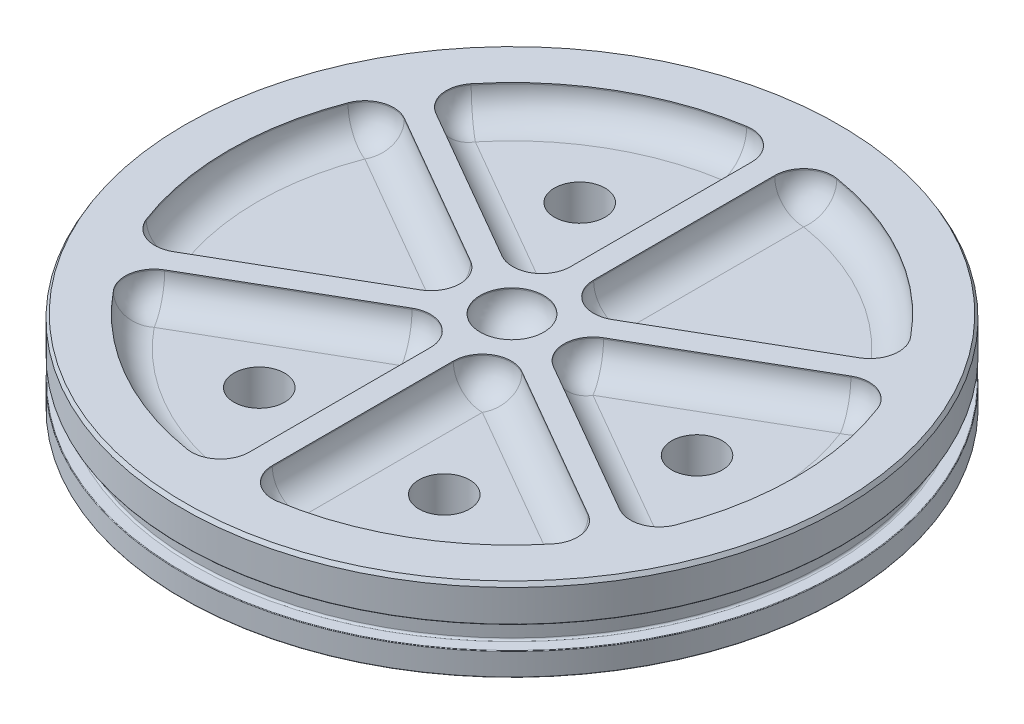
from build123d import *

# Parameters (mm, degrees)
SKETCH6_R                        = 65.405
BOSS_EXTRUDE1_DEPTH              = 2.54
PIPE_TAP_DRILL_FOR_1_4_TAP_GN2_D = 11.1252
CNC_ID_FILLET_R                  = 0.4064
CNC_OD_FILLET_R                  = 0.127
CNC_CHAMFERS_SIZE                = 0.508
CNC_CHAMFERS_SIZE2               = 0.87988181
BOSS_EXTRUDE2_START              = -6.604
SKETCH7_R                        = 6.985
BOSS_EXTRUDE2_DEPTH              = 6.604
FILLET1_R                        = 6.35
SKETCH8_R                        = 6.985
CUT_EXTRUDE1_DEPTH               = 3.81
FILLET2_R                        = 6.35


with BuildPart() as part:
    # Sketch1 → Revolve1 (revolve)
    with BuildSketch(Plane.XY, mode=Mode.PRIVATE) as revolve1_sk:
        Polygon((0, 0), (72.39, 0), (72.39, 5.08), (69.469, 5.08), (69.469, 10.0584), (72.39, 10.0584), (72.39, 18.034), (62.23, 18.034), (62.23, 11.43), (0, 11.43), align=None)
    revolve(revolve1_sk.sketch.rotate(Axis((0, 48.192213231, 0), (0, -1, 0)), 180), axis=Axis((0, 48.192213231, 0), (0, -1, 0)))

    # Sketch6 → Boss-Extrude1 (add)
    with BuildSketch(Plane.XZ):
        Circle(SKETCH6_R)
    extrude(amount=BOSS_EXTRUDE1_DEPTH)

    # Pipe Tap Drill for 1/4 Tap - GN2 (through all)
    with Locations(Plane(origin=(0, 11.43, 0), x_dir=(1, 0, 0), z_dir=(0, 1, 0))):
        with Locations((20.32, -35.19527241), (-20.32, 35.19527241), (40.64, 0), (-20.32, -35.19527241)):
            Hole(PIPE_TAP_DRILL_FOR_1_4_TAP_GN2_D / 2)

    # CNC ID Fillet
    cnc_id_fillet_edges = [part.edges().sort_by_distance(p)[0] for p in [
        (69.469, 10.0584, 0),
        (69.469, 5.08, 0),
        (-65.405, 0, 0),
    ]]
    fillet(cnc_id_fillet_edges, radius=CNC_ID_FILLET_R)

    # CNC OD Fillet
    cnc_od_fillet_edges = [part.edges().sort_by_distance(p)[0] for p in [
        (72.39, 5.08, 0),
        (72.39, 0, 0),
        (-65.405, -2.54, 0),
        (72.39, 10.0584, 0),
    ]]
    fillet(cnc_od_fillet_edges, radius=CNC_OD_FILLET_R)

    # CNC Chamfers
    cnc_chamfers_edges = [part.edges().sort_by_distance(p)[0] for p in [
        (72.39, 18.034, 0),
    ]]
    cnc_chamfers_side = [part.faces().sort_by_distance(p)[0] for p in [
        (70.342501604, 18.034, 0),
    ]]
    chamfer(cnc_chamfers_edges, length=CNC_CHAMFERS_SIZE, length2=CNC_CHAMFERS_SIZE2, reference=cnc_chamfers_side[0])

    # Sketch7 → Boss-Extrude2 (add)
    with BuildSketch(Plane(origin=(0, 18.034, 0), x_dir=(1, 0, 0), z_dir=(0, 1, 0)).offset(BOSS_EXTRUDE2_START)):
        with BuildLine():
            ThreePointArc((12.065, 9.898670365), (5.715, 9.898670365), (2.54, 15.397931679))
            Line((2.54, 15.397931679), (2.54, 62.178141658))
            ThreePointArc((2.54, 62.178141658), (0, 62.23), (-2.54, 62.178141658))
            Line((-2.54, 62.178141658), (-2.54, 15.397931679))
            ThreePointArc((-2.54, 15.397931679), (-5.715, 9.898670365), (-12.065, 9.898670365))
            Line((-12.065, 9.898670365), (-52.577850236, 33.288775354))
            ThreePointArc((-52.577850236, 33.288775354), (-53.892760878, 31.115), (-55.117850236, 28.889366303))
            Line((-55.117850236, 28.889366303), (-14.605, 5.499261314))
            ThreePointArc((-14.605, 5.499261314), (-11.43, 0), (-14.605, -5.499261314))
            Line((-14.605, -5.499261314), (-55.117850236, -28.889366303))
            ThreePointArc((-55.117850236, -28.889366303), (-53.892760878, -31.115), (-52.577850236, -33.288775354))
            Line((-52.577850236, -33.288775354), (-12.065, -9.898670365))
            ThreePointArc((-12.065, -9.898670365), (-5.715, -9.898670365), (-2.54, -15.397931679))
            Line((-2.54, -15.397931679), (-2.54, -62.178141658))
            ThreePointArc((-2.54, -62.178141658), (0, -62.23), (2.54, -62.178141658))
            Line((2.54, -62.178141658), (2.54, -15.397931679))
            ThreePointArc((2.54, -15.397931679), (5.715, -9.898670365), (12.065, -9.898670365))
            Line((12.065, -9.898670365), (52.577850236, -33.288775354))
            ThreePointArc((52.577850236, -33.288775354), (53.892760878, -31.115), (55.117850236, -28.889366303))
            Line((55.117850236, -28.889366303), (14.605, -5.499261314))
            ThreePointArc((14.605, -5.499261314), (11.43, 0), (14.605, 5.499261314))
            Line((14.605, 5.499261314), (55.117850236, 28.889366303))
            ThreePointArc((55.117850236, 28.889366303), (53.892760878, 31.115), (52.577850236, 33.288775354))
            Line((52.577850236, 33.288775354), (12.065, 9.898670365))
        make_face()
        with Locations(Location((0, 0, 0), (0, 0, 180))):
            Circle(SKETCH7_R, mode=Mode.SUBTRACT)
    extrude(amount=BOSS_EXTRUDE2_DEPTH)

    # Fillet1
    fillet1_edges = [part.edges().sort_by_distance(p)[0] for p in [
        (-32.321425118, 11.43, -21.59372286),
        (-52.577850236, 14.732, -33.288775354),
        (-55.117850236, 14.732, -28.889366303),
        (-34.861425118, 11.43, 17.194313809),
        (-55.117850236, 14.732, 28.889366303),
        (-52.577850236, 14.732, 33.288775354),
        (-2.54, 11.43, 38.788036668),
        (-2.54, 14.732, 62.178141658),
        (2.54, 14.732, 62.178141658),
        (32.321425118, 11.43, 21.59372286),
        (52.577850236, 14.732, 33.288775354),
        (55.117850236, 14.732, 28.889366303),
        (34.861425118, 11.43, -17.194313809),
        (55.117850236, 14.732, -28.889366303),
        (52.577850236, 14.732, -33.288775354),
        (2.54, 11.43, -38.788036668),
        (2.54, 14.732, -62.178141658),
        (-2.54, 14.732, -62.178141658),
        (-5.715, 11.43, -9.898670365),
        (-2.54, 11.43, -38.788036668),
        (5.715, 11.43, -9.898670365),
        (32.321425118, 11.43, -21.59372286),
        (11.43, 11.43, 0),
        (34.861425118, 11.43, 17.194313809),
        (5.715, 11.43, 9.898670365),
        (2.54, 11.43, 38.788036668),
        (-5.715, 11.43, 9.898670365),
        (-32.321425118, 11.43, 21.59372286),
        (-11.43, 11.43, 0),
        (-34.861425118, 11.43, -17.194313809),
        (-31.115, 11.43, 53.892760878),
        (31.115, 11.43, 53.892760878),
        (62.23, 11.43, 0),
        (31.115, 11.43, -53.892760878),
        (-31.115, 11.43, -53.892760878),
        (-62.23, 11.43, 0),
        (6.985, 11.43, 0),
    ]]
    fillet(fillet1_edges, radius=FILLET1_R)

    # Sketch8 → Cut-Extrude1 (cut)
    with BuildSketch(Plane.XZ.offset(2.54)):
        with Locations(Location((0, 0, 0), (0, 0, 180))):
            Circle(SKETCH8_R)
        with BuildLine():
            Line((-49.047156937, -25.384449893), (-14.605, -5.499261314))
            ThreePointArc((-14.605, -5.499261314), (-11.43, 0), (-14.605, 5.499261314))
            Line((-14.605, 5.499261314), (-49.047156937, 25.384449893))
            ThreePointArc((-49.047156937, 25.384449893), (-54.349879838, 25.868105531), (-58.156492953, 22.1448691))
            ThreePointArc((-58.156492953, 22.1448691), (-62.23, 0), (-58.156492953, -22.1448691))
            ThreePointArc((-58.156492953, -22.1448691), (-54.349879838, -25.868105531), (-49.047156937, -25.384449893))
        make_face()
        with BuildLine():
            Line((-2.54, 15.397931679), (-2.54, 55.168308838))
            ThreePointArc((-2.54, 55.168308838), (-4.772503381, 60.002429398), (-9.900227273, 61.437434842))
            ThreePointArc((-9.900227273, 61.437434842), (-31.115, 53.892760878), (-48.25626568, 39.292565742))
            ThreePointArc((-48.25626568, 39.292565742), (-49.577376457, 34.134323866), (-46.507156937, 29.783858944))
            Line((-46.507156937, 29.783858944), (-12.065, 9.898670365))
            ThreePointArc((-12.065, 9.898670365), (-5.715, 9.898670365), (-2.54, 15.397931679))
        make_face()
        with BuildLine():
            Line((12.065, 9.898670365), (46.507156937, 29.783858944))
            ThreePointArc((46.507156937, 29.783858944), (49.577376457, 34.134323866), (48.25626568, 39.292565742))
            ThreePointArc((48.25626568, 39.292565742), (31.115, 53.892760878), (9.900227273, 61.437434842))
            ThreePointArc((9.900227273, 61.437434842), (4.772503381, 60.002429398), (2.54, 55.168308838))
            Line((2.54, 55.168308838), (2.54, 15.397931679))
            ThreePointArc((2.54, 15.397931679), (5.715, 9.898670365), (12.065, 9.898670365))
        make_face()
        with BuildLine():
            Line((14.605, -5.499261314), (49.047156937, -25.384449893))
            ThreePointArc((49.047156937, -25.384449893), (54.349879838, -25.868105531), (58.156492953, -22.1448691))
            ThreePointArc((58.156492953, -22.1448691), (62.23, 0), (58.156492953, 22.1448691))
            ThreePointArc((58.156492953, 22.1448691), (54.349879838, 25.868105531), (49.047156937, 25.384449893))
            Line((49.047156937, 25.384449893), (14.605, 5.499261314))
            ThreePointArc((14.605, 5.499261314), (11.43, 0), (14.605, -5.499261314))
        make_face()
        with BuildLine():
            Line((2.54, -15.397931679), (2.54, -55.168308838))
            ThreePointArc((2.54, -55.168308838), (4.772503381, -60.002429398), (9.900227273, -61.437434842))
            ThreePointArc((9.900227273, -61.437434842), (31.115, -53.892760878), (48.25626568, -39.292565742))
            ThreePointArc((48.25626568, -39.292565742), (49.577376457, -34.134323866), (46.507156937, -29.783858944))
            Line((46.507156937, -29.783858944), (12.065, -9.898670365))
            ThreePointArc((12.065, -9.898670365), (5.715, -9.898670365), (2.54, -15.397931679))
        make_face()
        with BuildLine():
            Line((-12.065, -9.898670365), (-46.507156937, -29.783858944))
            ThreePointArc((-46.507156937, -29.783858944), (-49.577376457, -34.134323866), (-48.25626568, -39.292565742))
            ThreePointArc((-48.25626568, -39.292565742), (-31.115, -53.892760878), (-9.900227273, -61.437434842))
            ThreePointArc((-9.900227273, -61.437434842), (-4.772503381, -60.002429398), (-2.54, -55.168308838))
            Line((-2.54, -55.168308838), (-2.54, -15.397931679))
            ThreePointArc((-2.54, -15.397931679), (-5.715, -9.898670365), (-12.065, -9.898670365))
        make_face()
    extrude(amount=-CUT_EXTRUDE1_DEPTH, mode=Mode.SUBTRACT)

    # Fillet2
    # the kernel refuses this fillet: 6.35 mm, written as the material it adds along each edge
    with BuildSketch(Plane(origin=(52.222156937, 1.27, 19.885188579), x_dir=(0.9345411048171216, 0, 0.35585520005641874), z_dir=(0.35585520005641874, 0, -0.9345411048171216))) as fillet2_piece_1:
        with BuildLine():
            CenterArc((0.530128867, 6.35), FILLET2_R, 270, 66.421821522)
            Line((6.35, 3.81), (6.466397423, 3.7592))
            ThreePointArc((6.466397423, 3.7592), (6.477, 1.905), (6.477, 0))
            Line((6.477, 0), (6.35, -0.127))
            Line((6.35, -0.127), (0.530128867, -0.127))
            Line((0.530128867, -0.127), (0.530128867, 0))
        make_face()
    revolve(axis=Axis((52.222156937, 1.27, 19.885188579), (0, -1, 0)), revolution_arc=99.154133285)
    with BuildSketch(Plane(origin=(0, 1.27, 0), x_dir=(0.9345411048171222, 0, -0.3558552000564174), z_dir=(-0.3558552000564174, 0, -0.9345411048171222))) as fillet2_piece_2:
        with BuildLine():
            CenterArc((56.410128867, 6.35), FILLET2_R, 270, 66.421821522)
            Line((62.23, 3.81), (62.346397423, 3.7592))
            ThreePointArc((62.346397423, 3.7592), (62.357, 1.905), (62.357, 0))
            Line((62.357, 0), (62.23, -0.127))
            Line((62.23, -0.127), (56.410128867, -0.127))
            Line((56.410128867, -0.127), (56.410128867, 0))
        make_face()
    revolve(axis=Axis((0, 1.27, 0), (0, -1, 0)), revolution_arc=41.691733431)
    with BuildSketch(Plane(origin=(52.222156937, 1.27, -19.885188579), x_dir=(-0.49999999999999867, 0, -0.8660254037844394), z_dir=(-0.8660254037844394, 0, 0.49999999999999867))) as fillet2_piece_3:
        with BuildLine():
            CenterArc((0.530128867, 6.35), FILLET2_R, 270, 66.421821522)
            Line((6.35, 3.81), (6.466397423, 3.7592))
            ThreePointArc((6.466397423, 3.7592), (6.477, 1.905), (6.477, 0))
            Line((6.477, 0), (6.35, -0.127))
            Line((6.35, -0.127), (0.530128867, -0.127))
            Line((0.530128867, -0.127), (0.530128867, 0))
        make_face()
    revolve(axis=Axis((52.222156937, 1.27, -19.885188579), (0, -1, 0)), revolution_arc=99.154133285)
    with BuildSketch(Plane(origin=(14.605, 1.27, -5.499261314), x_dir=(0.49999999999999856, 0, 0.8660254037844395), z_dir=(0.8660254037844395, 0, -0.49999999999999856)), Plane(origin=(12.065, 1.27, 9.898670365), x_dir=(-0.5000000000000013, 0, 0.8660254037844377), z_dir=(0.8660254037844378, 0, 0.5000000000000014)), Plane(origin=(-2.54, 1.27, -55.168308838), x_dir=(-1, 0, 0), z_dir=(0, 0, 1)), Plane(origin=(-46.507156937, 1.27, 29.783858944), x_dir=(0.4999999999999987, 0, 0.8660254037844394), z_dir=(0.8660254037844395, 0, -0.4999999999999987)), Plane(origin=(-2.54, 1.27, 15.397931679), x_dir=(-1, 0, 0), z_dir=(0, 0, 1)), Plane(origin=(49.047156937, 1.27, 25.384449893), x_dir=(0.5000000000000013, 0, -0.8660254037844377), z_dir=(-0.8660254037844378, 0, -0.5000000000000014)), Plane(origin=(2.54, 1.27, 55.168308838), x_dir=(1, 0, 0), z_dir=(0, 0, -1)), Plane(origin=(-12.065, 1.27, -9.898670365), x_dir=(0.5000000000000012, 0, -0.866025403784438), z_dir=(-0.866025403784438, 0, -0.5000000000000012))) as fillet2_piece_4:
        with BuildLine():
            CenterArc((5.819871133, 6.35), FILLET2_R, 203.578178478, 66.421821522)
            Line((0, 3.81), (-0.116397423, 3.7592))
            ThreePointArc((-0.116397423, 3.7592), (-0.127, 1.905), (-0.127, 0))
            Line((-0.127, 0), (0, -0.127))
            Line((0, -0.127), (5.819871133, -0.127))
            Line((5.819871133, -0.127), (5.819871133, 0))
        make_face()
    extrude(amount=39.770377158)
    with BuildSketch(Plane(origin=(17.78, 1.27, 0), x_dir=(-0.5000000000000023, 0, 0.8660254037844373), z_dir=(0.8660254037844373, 0, 0.5000000000000023))) as fillet2_piece_5:
        with BuildLine():
            CenterArc((0.530128867, 6.35), FILLET2_R, 270, 66.421821522)
            Line((6.35, 3.81), (6.466397423, 3.7592))
            ThreePointArc((6.466397423, 3.7592), (6.477, 1.905), (6.477, 0))
            Line((6.477, 0), (6.35, -0.127))
            Line((6.35, -0.127), (0.530128867, -0.127))
            Line((0.530128867, -0.127), (0.530128867, 0))
        make_face()
    revolve(axis=Axis((17.78, 1.27, 0), (0, -1, 0)), revolution_arc=120)
    with BuildSketch(Plane(origin=(8.89, 1.27, 55.168308838), x_dir=(0.15909090909090845, 0, 0.9872639376806124), z_dir=(0.9872639376806124, 0, -0.15909090909090845))) as fillet2_piece_6:
        with BuildLine():
            CenterArc((0.530128867, 6.35), FILLET2_R, 270, 66.421821522)
            Line((6.35, 3.81), (6.466397423, 3.7592))
            ThreePointArc((6.466397423, 3.7592), (6.477, 1.905), (6.477, 0))
            Line((6.477, 0), (6.35, -0.127))
            Line((6.35, -0.127), (0.530128867, -0.127))
            Line((0.530128867, -0.127), (0.530128867, 0))
        make_face()
    revolve(axis=Axis((8.89, 1.27, 55.168308838), (0, -1, 0)), revolution_arc=99.154133285)
    with BuildSketch(Plane(origin=(0, 1.27, 0), x_dir=(0.7754501957262113, 0, 0.6314087376241958), z_dir=(0.6314087376241958, 0, -0.7754501957262113))) as fillet2_piece_7:
        with BuildLine():
            CenterArc((56.410128867, 6.35), FILLET2_R, 270, 66.421821522)
            Line((62.23, 3.81), (62.346397423, 3.7592))
            ThreePointArc((62.346397423, 3.7592), (62.357, 1.905), (62.357, 0))
            Line((62.357, 0), (62.23, -0.127))
            Line((62.23, -0.127), (56.410128867, -0.127))
            Line((56.410128867, -0.127), (56.410128867, 0))
        make_face()
    revolve(axis=Axis((0, 1.27, 0), (0, -1, 0)), revolution_arc=41.691733431)
    with BuildSketch(Plane(origin=(43.332156937, 1.27, 35.283120258), x_dir=(0.49999999999999944, 0, -0.866025403784439), z_dir=(-0.866025403784439, 0, -0.49999999999999944))) as fillet2_piece_8:
        with BuildLine():
            CenterArc((0.530128867, 6.35), FILLET2_R, 270, 66.421821522)
            Line((6.35, 3.81), (6.466397423, 3.7592))
            ThreePointArc((6.466397423, 3.7592), (6.477, 1.905), (6.477, 0))
            Line((6.477, 0), (6.35, -0.127))
            Line((6.35, -0.127), (0.530128867, -0.127))
            Line((0.530128867, -0.127), (0.530128867, 0))
        make_face()
    revolve(axis=Axis((43.332156937, 1.27, 35.283120258), (0, -1, 0)), revolution_arc=99.154133285)
    with BuildSketch(Plane(origin=(8.89, 1.27, 15.397931679), x_dir=(-1, 0, 0), z_dir=(0, 0, 1))) as fillet2_piece_9:
        with BuildLine():
            CenterArc((0.530128867, 6.35), FILLET2_R, 270, 66.421821522)
            Line((6.35, 3.81), (6.466397423, 3.7592))
            ThreePointArc((6.466397423, 3.7592), (6.477, 1.905), (6.477, 0))
            Line((6.477, 0), (6.35, -0.127))
            Line((6.35, -0.127), (0.530128867, -0.127))
            Line((0.530128867, -0.127), (0.530128867, 0))
        make_face()
    revolve(axis=Axis((8.89, 1.27, 15.397931679), (0, -1, 0)), revolution_arc=120)
    with BuildSketch(Plane(origin=(-8.89, 1.27, -15.397931679), x_dir=(1, 0, 0), z_dir=(0, 0, -1))) as fillet2_piece_10:
        with BuildLine():
            CenterArc((0.530128867, 6.35), FILLET2_R, 270, 66.421821522)
            Line((6.35, 3.81), (6.466397423, 3.7592))
            ThreePointArc((6.466397423, 3.7592), (6.477, 1.905), (6.477, 0))
            Line((6.477, 0), (6.35, -0.127))
            Line((6.35, -0.127), (0.530128867, -0.127))
            Line((0.530128867, -0.127), (0.530128867, 0))
        make_face()
    revolve(axis=Axis((-8.89, 1.27, -15.397931679), (0, -1, 0)), revolution_arc=120)
    with BuildSketch(Plane(origin=(-8.89, 1.27, -55.168308838), x_dir=(-0.15909090909090665, 0, -0.9872639376806127), z_dir=(-0.9872639376806127, 0, 0.15909090909090665))) as fillet2_piece_11:
        with BuildLine():
            CenterArc((0.530128867, 6.35), FILLET2_R, 270, 66.421821522)
            Line((6.35, 3.81), (6.466397423, 3.7592))
            ThreePointArc((6.466397423, 3.7592), (6.477, 1.905), (6.477, 0))
            Line((6.477, 0), (6.35, -0.127))
            Line((6.35, -0.127), (0.530128867, -0.127))
            Line((0.530128867, -0.127), (0.530128867, 0))
        make_face()
    revolve(axis=Axis((-8.89, 1.27, -55.168308838), (0, -1, 0)), revolution_arc=99.154133285)
    with BuildSketch(Plane(origin=(0, 1.27, 0), x_dir=(-0.7754501957262119, 0, -0.6314087376241951), z_dir=(-0.6314087376241951, 0, 0.7754501957262119))) as fillet2_piece_12:
        with BuildLine():
            CenterArc((56.410128867, 6.35), FILLET2_R, 270, 66.421821522)
            Line((62.23, 3.81), (62.346397423, 3.7592))
            ThreePointArc((62.346397423, 3.7592), (62.357, 1.905), (62.357, 0))
            Line((62.357, 0), (62.23, -0.127))
            Line((62.23, -0.127), (56.410128867, -0.127))
            Line((56.410128867, -0.127), (56.410128867, 0))
        make_face()
    revolve(axis=Axis((0, 1.27, 0), (0, -1, 0)), revolution_arc=41.691733431)
    with BuildSketch(Plane(origin=(-43.332156937, 1.27, -35.283120258), x_dir=(-0.5000000000000009, 0, 0.8660254037844382), z_dir=(0.8660254037844382, 0, 0.5000000000000009))) as fillet2_piece_13:
        with BuildLine():
            CenterArc((0.530128867, 6.35), FILLET2_R, 270, 66.421821522)
            Line((6.35, 3.81), (6.466397423, 3.7592))
            ThreePointArc((6.466397423, 3.7592), (6.477, 1.905), (6.477, 0))
            Line((6.477, 0), (6.35, -0.127))
            Line((6.35, -0.127), (0.530128867, -0.127))
            Line((0.530128867, -0.127), (0.530128867, 0))
        make_face()
    revolve(axis=Axis((-43.332156937, 1.27, -35.283120258), (0, -1, 0)), revolution_arc=99.154133285)
    with BuildSketch(Plane(origin=(46.507156937, 1.27, -29.783858944), x_dir=(0, -1, 0), z_dir=(-0.8660254037844395, 0, 0.49999999999999856)), Plane(origin=(2.54, 1.27, -15.397931679), x_dir=(0, -1, 0), z_dir=(0, 0, -1)), Plane(origin=(-14.605, 1.27, 5.499261314), x_dir=(0, -1, 0), z_dir=(-0.8660254037844394, 0, 0.4999999999999987)), Plane(origin=(-49.047156937, 1.27, -25.384449893), x_dir=(0, -1, 0), z_dir=(0.8660254037844378, 0, 0.5000000000000014))) as fillet2_piece_14:
        with BuildLine():
            CenterArc((6.35, -5.819871133), FILLET2_R, 113.578178478, 66.421821522)
            Line((0, -5.819871133), (-0.127, -5.819871133))
            Line((-0.127, -5.819871133), (-0.127, 0))
            Line((-0.127, 0), (0, 0.127))
            ThreePointArc((0, 0.127), (1.905, 0.127), (3.7592, 0.116397423))
            Line((3.7592, 0.116397423), (3.81, 0))
        make_face()
    extrude(amount=39.770377158)
    with BuildSketch(Plane(origin=(43.332156937, 1.27, -35.283120258), x_dir=(0.7754501957262147, 0, -0.6314087376241917), z_dir=(-0.6314087376241917, 0, -0.7754501957262147))) as fillet2_piece_15:
        with BuildLine():
            CenterArc((0.530128867, 6.35), FILLET2_R, 270, 66.421821522)
            Line((0.530128867, 0), (0.530128867, -0.127))
            Line((0.530128867, -0.127), (6.35, -0.127))
            Line((6.35, -0.127), (6.477, 0))
            ThreePointArc((6.477, 0), (6.477, 1.905), (6.466397423, 3.7592))
            Line((6.466397423, 3.7592), (6.35, 3.81))
        make_face()
    revolve(axis=Axis((43.332156937, 1.27, -35.283120258), (0, -1, 0)), revolution_arc=99.154133285)
    with BuildSketch(Plane(origin=(0, 1.27, 0), x_dir=(0.15909090909091067, 0, -0.9872639376806122), z_dir=(-0.9872639376806122, 0, -0.15909090909091067))) as fillet2_piece_16:
        with BuildLine():
            CenterArc((56.410128867, 6.35), FILLET2_R, 270, 66.421821522)
            Line((56.410128867, 0), (56.410128867, -0.127))
            Line((56.410128867, -0.127), (62.23, -0.127))
            Line((62.23, -0.127), (62.357, 0))
            ThreePointArc((62.357, 0), (62.357, 1.905), (62.346397423, 3.7592))
            Line((62.346397423, 3.7592), (62.23, 3.81))
        make_face()
    revolve(axis=Axis((0, 1.27, 0), (0, -1, 0)), revolution_arc=41.691733431)
    with BuildSketch(Plane(origin=(8.89, 1.27, -55.168308838), x_dir=(-1, 0, 0), z_dir=(0, 0, 1))) as fillet2_piece_17:
        with BuildLine():
            CenterArc((0.530128867, 6.35), FILLET2_R, 270, 66.421821522)
            Line((0.530128867, 0), (0.530128867, -0.127))
            Line((0.530128867, -0.127), (6.35, -0.127))
            Line((6.35, -0.127), (6.477, 0))
            ThreePointArc((6.477, 0), (6.477, 1.905), (6.466397423, 3.7592))
            Line((6.466397423, 3.7592), (6.35, 3.81))
        make_face()
    revolve(axis=Axis((8.89, 1.27, -55.168308838), (0, -1, 0)), revolution_arc=99.154133285)
    with BuildSketch(Plane(origin=(8.89, 1.27, -15.397931679), x_dir=(0.49999999999999967, 0, 0.8660254037844388), z_dir=(0.8660254037844388, 0, -0.49999999999999967))) as fillet2_piece_18:
        with BuildLine():
            CenterArc((0.530128867, 6.35), FILLET2_R, 270, 66.421821522)
            Line((0.530128867, 0), (0.530128867, -0.127))
            Line((0.530128867, -0.127), (6.35, -0.127))
            Line((6.35, -0.127), (6.477, 0))
            ThreePointArc((6.477, 0), (6.477, 1.905), (6.466397423, 3.7592))
            Line((6.466397423, 3.7592), (6.35, 3.81))
        make_face()
    revolve(axis=Axis((8.89, 1.27, -15.397931679), (0, -1, 0)), revolution_arc=120)
    with BuildSketch(Plane(origin=(-43.332156937, 1.27, 35.283120258), x_dir=(-0.7754501957262155, 0, 0.6314087376241906), z_dir=(0.6314087376241906, 0, 0.7754501957262155))) as fillet2_piece_19:
        with BuildLine():
            CenterArc((0.530128867, 6.35), FILLET2_R, 270, 66.421821522)
            Line((6.35, 3.81), (6.466397423, 3.7592))
            ThreePointArc((6.466397423, 3.7592), (6.477, 1.905), (6.477, 0))
            Line((6.477, 0), (6.35, -0.127))
            Line((6.35, -0.127), (0.530128867, -0.127))
            Line((0.530128867, -0.127), (0.530128867, 0))
        make_face()
    revolve(axis=Axis((-43.332156937, 1.27, 35.283120258), (0, -1, 0)), revolution_arc=99.154133285)
    with BuildSketch(Plane(origin=(0, 1.27, 0), x_dir=(-0.15909090909091095, 0, 0.987263937680612), z_dir=(0.987263937680612, 0, 0.15909090909091095))) as fillet2_piece_20:
        with BuildLine():
            CenterArc((56.410128867, 6.35), FILLET2_R, 270, 66.421821522)
            Line((62.23, 3.81), (62.346397423, 3.7592))
            ThreePointArc((62.346397423, 3.7592), (62.357, 1.905), (62.357, 0))
            Line((62.357, 0), (62.23, -0.127))
            Line((62.23, -0.127), (56.410128867, -0.127))
            Line((56.410128867, -0.127), (56.410128867, 0))
        make_face()
    revolve(axis=Axis((0, 1.27, 0), (0, -1, 0)), revolution_arc=41.691733431)
    with BuildSketch(Plane(origin=(-8.89, 1.27, 55.168308838), x_dir=(1, 0, 0), z_dir=(0, 0, -1))) as fillet2_piece_21:
        with BuildLine():
            CenterArc((0.530128867, 6.35), FILLET2_R, 270, 66.421821522)
            Line((6.35, 3.81), (6.466397423, 3.7592))
            ThreePointArc((6.466397423, 3.7592), (6.477, 1.905), (6.477, 0))
            Line((6.477, 0), (6.35, -0.127))
            Line((6.35, -0.127), (0.530128867, -0.127))
            Line((0.530128867, -0.127), (0.530128867, 0))
        make_face()
    revolve(axis=Axis((-8.89, 1.27, 55.168308838), (0, -1, 0)), revolution_arc=99.154133285)
    with BuildSketch(Plane(origin=(-8.89, 1.27, 15.397931679), x_dir=(-0.49999999999999867, 0, -0.8660254037844395), z_dir=(-0.8660254037844395, 0, 0.49999999999999867))) as fillet2_piece_22:
        with BuildLine():
            CenterArc((0.530128867, 6.35), FILLET2_R, 270, 66.421821522)
            Line((6.35, 3.81), (6.466397423, 3.7592))
            ThreePointArc((6.466397423, 3.7592), (6.477, 1.905), (6.477, 0))
            Line((6.477, 0), (6.35, -0.127))
            Line((6.35, -0.127), (0.530128867, -0.127))
            Line((0.530128867, -0.127), (0.530128867, 0))
        make_face()
    revolve(axis=Axis((-8.89, 1.27, 15.397931679), (0, -1, 0)), revolution_arc=120)
    with BuildSketch(Plane(origin=(-17.78, 1.27, 0), x_dir=(0.5000000000000014, 0, -0.8660254037844378), z_dir=(-0.8660254037844378, 0, -0.5000000000000014))) as fillet2_piece_23:
        with BuildLine():
            CenterArc((0.530128867, 6.35), FILLET2_R, 270, 66.421821522)
            Line((0.530128867, 0), (0.530128867, -0.127))
            Line((0.530128867, -0.127), (6.35, -0.127))
            Line((6.35, -0.127), (6.477, 0))
            ThreePointArc((6.477, 0), (6.477, 1.905), (6.466397423, 3.7592))
            Line((6.466397423, 3.7592), (6.35, 3.81))
        make_face()
    revolve(axis=Axis((-17.78, 1.27, 0), (0, -1, 0)), revolution_arc=120)
    with BuildSketch(Plane(origin=(-52.222156937, 1.27, -19.885188579), x_dir=(-0.9345411048171217, 0, -0.35585520005641824), z_dir=(-0.35585520005641824, 0, 0.9345411048171217))) as fillet2_piece_24:
        with BuildLine():
            CenterArc((0.530128867, 6.35), FILLET2_R, 270, 66.421821522)
            Line((0.530128867, 0), (0.530128867, -0.127))
            Line((0.530128867, -0.127), (6.35, -0.127))
            Line((6.35, -0.127), (6.477, 0))
            ThreePointArc((6.477, 0), (6.477, 1.905), (6.466397423, 3.7592))
            Line((6.466397423, 3.7592), (6.35, 3.81))
        make_face()
    revolve(axis=Axis((-52.222156937, 1.27, -19.885188579), (0, -1, 0)), revolution_arc=99.154133285)
    with BuildSketch(Plane(origin=(0, 1.27, 0), x_dir=(-0.9345411048171226, 0, 0.3558552000564162), z_dir=(0.3558552000564162, 0, 0.9345411048171226))) as fillet2_piece_25:
        with BuildLine():
            CenterArc((56.410128867, 6.35), FILLET2_R, 270, 66.421821522)
            Line((56.410128867, 0), (56.410128867, -0.127))
            Line((56.410128867, -0.127), (62.23, -0.127))
            Line((62.23, -0.127), (62.357, 0))
            ThreePointArc((62.357, 0), (62.357, 1.905), (62.346397423, 3.7592))
            Line((62.346397423, 3.7592), (62.23, 3.81))
        make_face()
    revolve(axis=Axis((0, 1.27, 0), (0, -1, 0)), revolution_arc=41.691733431)
    with BuildSketch(Plane(origin=(-52.222156937, 1.27, 19.885188579), x_dir=(0.49999999999999817, 0, 0.8660254037844397), z_dir=(0.8660254037844397, 0, -0.49999999999999817))) as fillet2_piece_26:
        with BuildLine():
            CenterArc((0.530128867, 6.35), FILLET2_R, 270, 66.421821522)
            Line((0.530128867, 0), (0.530128867, -0.127))
            Line((0.530128867, -0.127), (6.35, -0.127))
            Line((6.35, -0.127), (6.477, 0))
            ThreePointArc((6.477, 0), (6.477, 1.905), (6.466397423, 3.7592))
            Line((6.466397423, 3.7592), (6.35, 3.81))
        make_face()
    revolve(axis=Axis((-52.222156937, 1.27, 19.885188579), (0, -1, 0)), revolution_arc=99.154133285)
    with BuildSketch(Plane(origin=(0, 1.27, 0), x_dir=(-1, 0, 0), z_dir=(0, 0, 1))) as fillet2_piece_27:
        with BuildLine():
            CenterArc((1.165128867, 6.35), FILLET2_R, 270, 66.421821522)
            Line((1.165128867, 0), (1.165128867, -0.127))
            Line((1.165128867, -0.127), (6.985, -0.127))
            Line((6.985, -0.127), (7.112, 0))
            ThreePointArc((7.112, 0), (7.112, 1.905), (7.101397423, 3.7592))
            Line((7.101397423, 3.7592), (6.985, 3.81))
        make_face()
    revolve(axis=Axis((0, 1.27, 0), (0, -1, 0)))


solid = part.part
